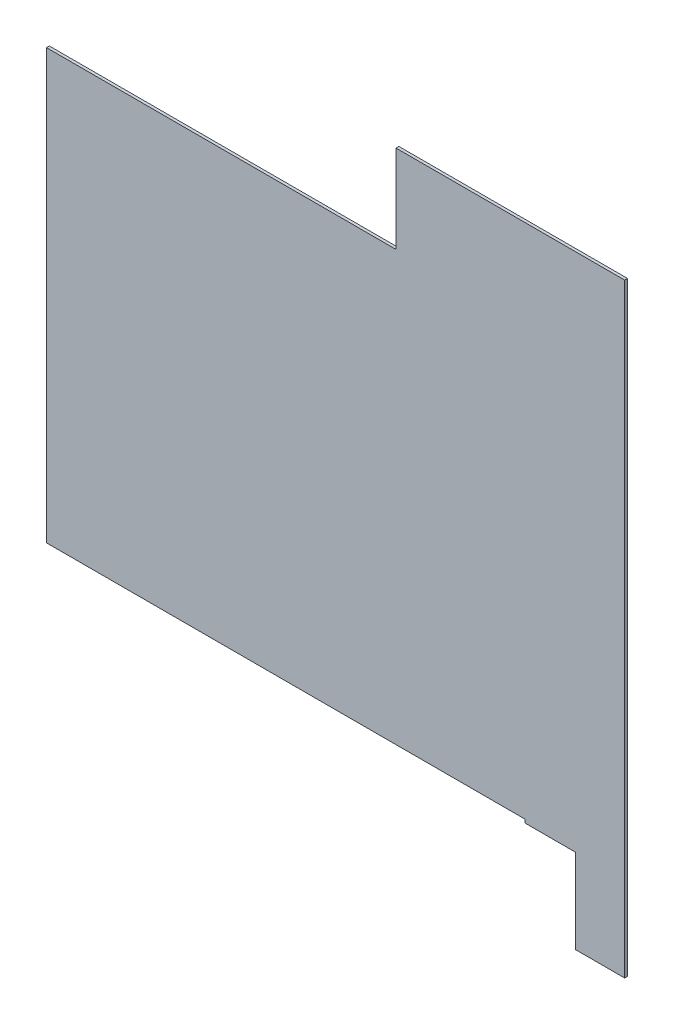
from build123d import *

# Parameters (mm, degrees)
BOSS_EXTRUDE1_DEPTH = 10
CUT_EXTRUDE2_DEPTH  = 330


with BuildPart() as part:
    # Sketch1 → Boss-Extrude1 (new body)
    with BuildSketch(Plane.XY):
        Polygon((1230, 1510), (0, 1510), (0, 0), (1685, 0), (1685, -309), (2035, -309), (2035, 1819), (1230, 1819), align=None)
    extrude(amount=BOSS_EXTRUDE1_DEPTH)

    # Sketch3 → Cut-Extrude2 (cut)
    with BuildSketch(Plane(origin=(-124.112118138, -342, 1004.457487155), x_dir=(-1, 0, 0), z_dir=(0, -1, 0))):
        with BuildLine():
            Line((-1887.112118138, 819.457487155), (-1466.112118138, 819.457487155))
            ThreePointArc((-1466.112118138, 819.457487155), (-1395.40144002, 848.746809036), (-1366.112118138, 919.457487155))
            Line((-1366.112118138, 919.457487155), (-1366.112118138, 2569.457487155))
            ThreePointArc((-1366.112118138, 2569.457487155), (-1395.40144002, 2640.168165273), (-1466.112118138, 2669.457487155))
            Line((-1466.112118138, 2669.457487155), (-1887.112118138, 2669.457487155))
            ThreePointArc((-1887.112118138, 2669.457487155), (-1957.822796257, 2640.168165273), (-1987.112118138, 2569.457487155))
            Line((-1987.112118138, 2569.457487155), (-1987.112118138, 919.457487155))
            ThreePointArc((-1987.112118138, 919.457487155), (-1957.822796257, 848.746809036), (-1887.112118138, 819.457487155))
        make_face()
    extrude(amount=-CUT_EXTRUDE2_DEPTH, mode=Mode.SUBTRACT)


solid = part.part
